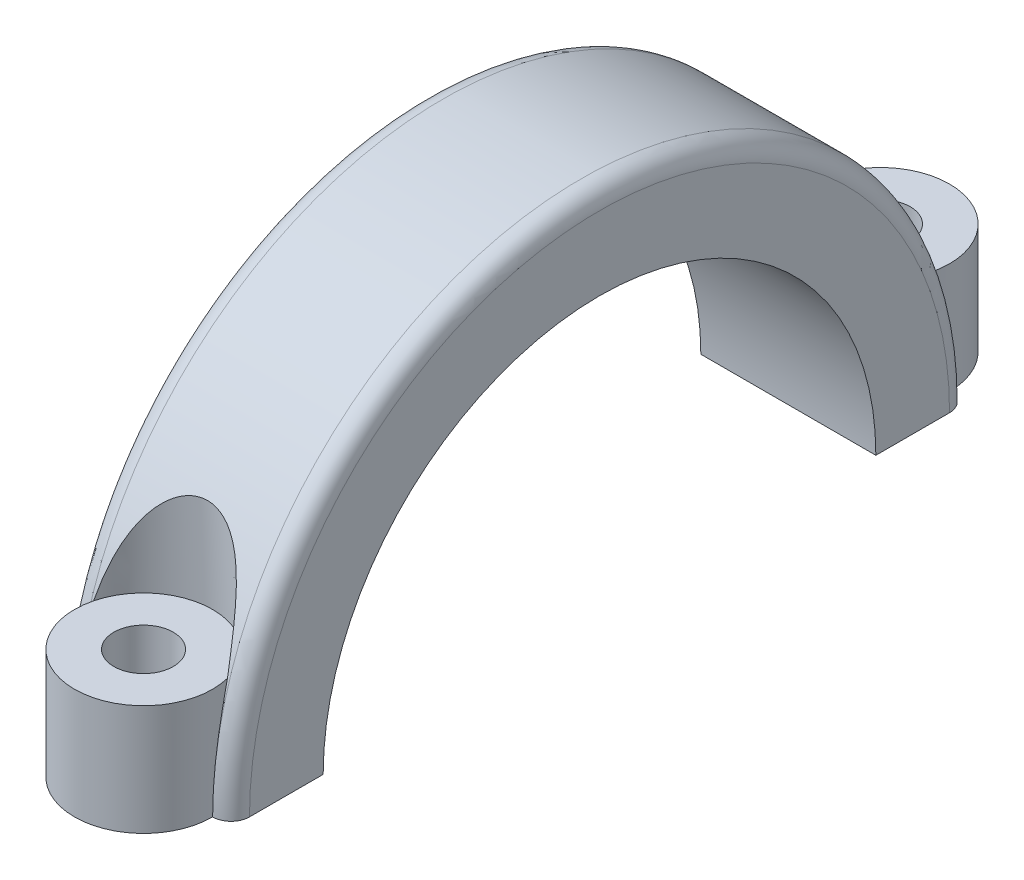
from build123d import *

# Parameters (mm, degrees)
BOSS_EXTRUDE1_DEPTH                               = 12.065
SKETCH2_R                                         = 9.525
BOSS_EXTRUDE2_DEPTH                               = 15.25
CUT_EXTRUDE1_START                                = -15.25
SKETCH2_2_R                                       = 9.525
CUT_EXTRUDE1_DEPTH                                = 15.25
CUT_EXTRUDE1_DRAFT                                = -3
CBORE_FOR_5_16_SOCKET_HEAD_CAP_SCREW1_D           = 8.2042
CBORE_FOR_5_16_SOCKET_HEAD_CAP_SCREW1_CBORE_D     = 13.49502
CBORE_FOR_5_16_SOCKET_HEAD_CAP_SCREW1_CBORE_DEPTH = 7.9375
MIRROR2_START                                     = -15.25
MIRROR2_COPY_1_SKETCH_R                           = 9.525
MIRROR2_COPY_1_DEPTH                              = 15.25
MIRROR2_COPY_1_DRAFT                              = -3
FILLET1_R                                         = 2.54


with BuildPart() as part:
    # Sketch1 → Boss-Extrude1 (new, symmetric)
    with BuildSketch(Plane(origin=(0, 0, 0), x_dir=(0, 0, -1), z_dir=(1, 0, 0))):
        with BuildLine():
            Line((-50.8, 0), (-38.1, 0))
            ThreePointArc((-38.1, 0), (0, 38.1), (38.1, 0))
            Line((38.1, 0), (50.8, 0))
            ThreePointArc((50.8, 0), (0, 50.8), (-50.8, 0))
        make_face()
    extrude(amount=BOSS_EXTRUDE1_DEPTH, both=True)

    # Sketch2 → Boss-Extrude2 (add)
    with BuildSketch(Plane.XZ):
        with Locations((0, -50.8)):
            Circle(SKETCH2_R)
    boss_extrude2 = extrude(amount=-BOSS_EXTRUDE2_DEPTH)


with BuildPart() as cut_extrude1_tool:
    # Sketch2<2> → Cut-Extrude1 (with draft: the straight prism first)
    with BuildSketch(Plane.XZ.offset(CUT_EXTRUDE1_START)):
        with Locations((0, -50.8)):
            Circle(SKETCH2_2_R)
    extrude(amount=-CUT_EXTRUDE1_DEPTH)
    # Cut-Extrude1: the draft: its side faces are tilted about the plane it starts from
    cut_extrude1_sides = [cut_extrude1_tool.faces().sort_by_distance(p)[0] for p in [
        (-9.525, 22.875, -50.8),
    ]]
    draft(cut_extrude1_sides, Plane.XZ.offset(CUT_EXTRUDE1_START), CUT_EXTRUDE1_DRAFT)


with BuildPart() as part_1:
    add(part.part)

    # Cut-Extrude1: cut by cut_extrude1_tool
    add(cut_extrude1_tool.part, mode=Mode.SUBTRACT)

    # CBORE for 5/16 Socket Head Cap Screw1 (through all)
    with Locations(Plane(origin=(0, 0, 0), x_dir=(-1, 0, 0), z_dir=(0, -1, 0))):
        with Locations((0, 50.8)):
            cbore_for_5_16_socket_head_cap_screw1 = CounterBoreHole(CBORE_FOR_5_16_SOCKET_HEAD_CAP_SCREW1_D / 2, CBORE_FOR_5_16_SOCKET_HEAD_CAP_SCREW1_CBORE_D / 2, CBORE_FOR_5_16_SOCKET_HEAD_CAP_SCREW1_CBORE_DEPTH)

    # Mirror1: Boss-Extrude2, CBORE for 5/16 Socket Head Cap Screw1 across plane
    add(boss_extrude2.mirror(Plane.XY))
    add(cbore_for_5_16_socket_head_cap_screw1.mirror(Plane.XY), mode=Mode.SUBTRACT)


with BuildPart() as mirror2_copy_1_tool:
    # Mirror2 copy 1 sketch → Mirror2 copy 1 (with draft: the straight prism first)
    with BuildSketch(Plane.XZ.offset(MIRROR2_START)):
        with Locations((0, 50.8)):
            Circle(MIRROR2_COPY_1_SKETCH_R)
    extrude(amount=-MIRROR2_COPY_1_DEPTH)
    # Mirror2 copy 1: the draft: its side faces are tilted about the plane it starts from
    mirror2_copy_1_sides = [mirror2_copy_1_tool.faces().sort_by_distance(p)[0] for p in [
        (-9.525, 22.875, 50.8),
    ]]
    draft(mirror2_copy_1_sides, Plane.XZ.offset(MIRROR2_START), MIRROR2_COPY_1_DRAFT)


with BuildPart() as part_2:
    add(part_1.part)

    # Mirror2 copy 1: cut by mirror2_copy_1_tool
    add(mirror2_copy_1_tool.part, mode=Mode.SUBTRACT)

    # Fillet1
    fillet1_edges = [part_2.edges().sort_by_distance(p)[0] for p in [
        (12.065, 50.8, 0),
        (-12.065, 50.8, 0),
    ]]
    fillet(fillet1_edges, radius=FILLET1_R - 0.0001)  # a hair under: the kernel refuses the full size


solid = part_2.part
